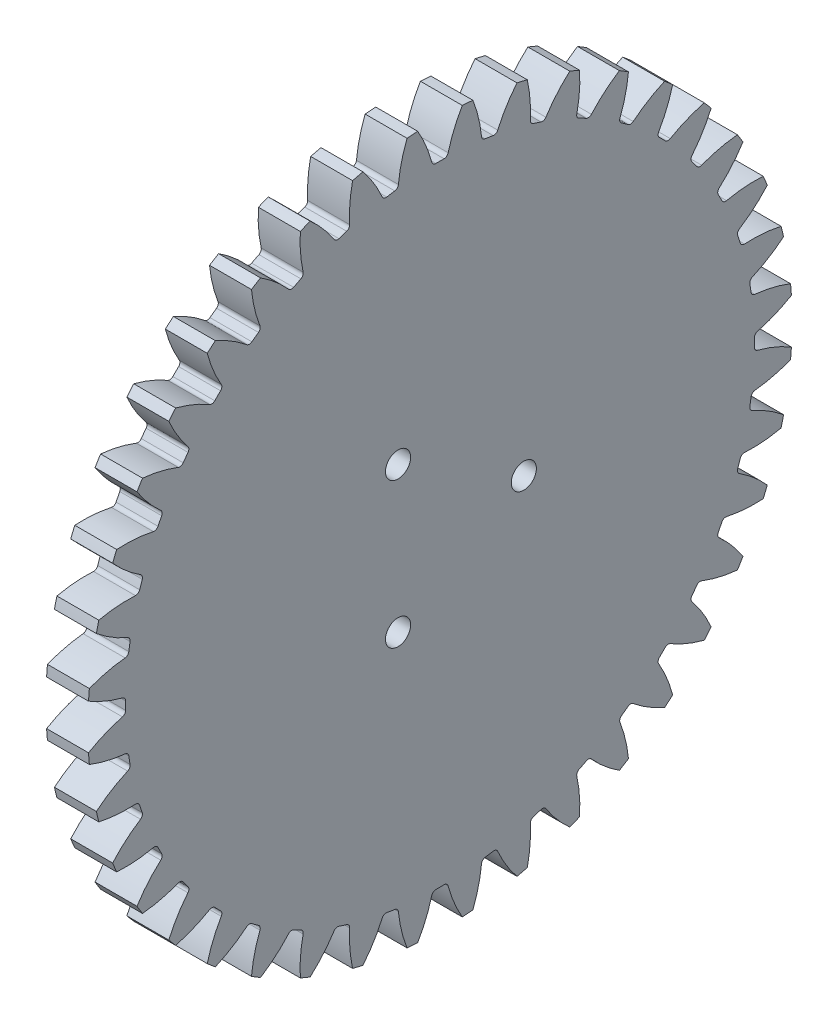
from build123d import *

# Parameters (mm, degrees)
BASPROSKE_W                = 5
BASPROSKE_H                = 42
TOOTHCUT_DEPTH             = 60.607046563
ROOTFILLETS_R              = 0.501
TEETHCUTS_COUNT            = 40
TEETHCUTS_ANGLE            = 351
ROOTFILLETS_OF_TEETHCUTS_R = 0.501
SKETCH1_R                  = 1.5
CUT_EXTRUDE1_DEPTH         = 60.487870435


with BuildPart() as part:
    # BasProSke → Base-Revolve (revolve)
    with BuildSketch(Plane(origin=(0, 0, 0), x_dir=(1, 0, 0), z_dir=(0, 1, 0))):
        with Locations((2.5, 21)):
            Rectangle(BASPROSKE_W, BASPROSKE_H)
    revolve(axis=Axis((-10, 0, 0), (1, 0, 0)))

    # TooCutSke → ToothCut (cut, through all)
    with BuildSketch(Plane(origin=(0, 0, 0), x_dir=(0, 0, -1), z_dir=(1, 0, 0))):
        with BuildLine():
            ThreePointArc((0.882812088, 37.488606854), (0, 37.499), (-0.882812088, 37.488606854))
            ThreePointArc((-0.882812088, 37.488606854), (-1.612748684, 39.782000434), (-2.678427154, 41.939960338))
            ThreePointArc((-2.678427154, 41.939960338), (0, 42.0254), (2.678427154, 41.939960338))
            ThreePointArc((2.678427154, 41.939960338), (1.612748684, 39.782000434), (0.882812088, 37.488606854))
        make_face()
    toothcut = extrude(amount=TOOTHCUT_DEPTH, mode=Mode.SUBTRACT)

    # RootFillets
    rootfillets_edges = [part.edges().sort_by_distance(p)[0] for p in [
        (2.5, 37.488606854, -0.882812088),
        (2.5, 37.488606854, 0.882812088),
    ]]
    fillet(rootfillets_edges, radius=ROOTFILLETS_R)

    # TeethCuts: ToothCut ×40 about axis
    teethcuts_axis = Axis((-10, 0, 0), (1, 0, 0))
    for i in range(1, TEETHCUTS_COUNT):
        add(toothcut.rotate(teethcuts_axis, i * TEETHCUTS_ANGLE / (TEETHCUTS_COUNT - 1)), mode=Mode.SUBTRACT)

    # RootFillets of TeethCuts
    rootfillets_of_teethcuts_edges = [part.edges().sort_by_distance(p)[0] for p in [
        (2.5, 37.165162131, 4.992566952),
        (2.5, 36.888957658, 6.736453364),
        (2.5, 35.926587773, 10.745012425),
        (2.5, 35.380979897, 12.424220802),
        (2.5, 33.80338159, 16.23288003),
        (2.5, 33.001804988, 17.80606269),
        (2.5, 30.847823966, 21.321040256),
        (2.5, 29.810016114, 22.749460219),
        (2.5, 27.132690537, 25.88420571),
        (2.5, 25.88420571, 27.132690537),
        (2.5, 22.749460219, 29.810016114),
        (2.5, 21.321040256, 30.847823966),
        (2.5, 17.80606269, 33.001804988),
        (2.5, 16.23288003, 33.80338159),
        (2.5, 12.424220802, 35.380979897),
        (2.5, 10.745012425, 35.926587773),
        (2.5, 6.736453364, 36.888957658),
        (2.5, 4.992566952, 37.165162131),
        (2.5, 0.882812088, 37.488606854),
        (2.5, -0.882812088, 37.488606854),
        (2.5, -4.992566952, 37.165162131),
        (2.5, -6.736453364, 36.888957658),
        (2.5, -10.745012425, 35.926587773),
        (2.5, -12.424220802, 35.380979897),
        (2.5, -16.23288003, 33.80338159),
        (2.5, -17.80606269, 33.001804988),
        (2.5, -21.321040256, 30.847823966),
        (2.5, -22.749460219, 29.810016114),
        (2.5, -25.88420571, 27.132690537),
        (2.5, -27.132690537, 25.88420571),
        (2.5, -29.810016114, 22.749460219),
        (2.5, -30.847823966, 21.321040256),
        (2.5, -33.001804988, 17.80606269),
        (2.5, -33.80338159, 16.23288003),
        (2.5, -35.380979897, 12.424220802),
        (2.5, -35.926587773, 10.745012425),
        (2.5, -36.888957658, 6.736453364),
        (2.5, -37.165162131, 4.992566952),
        (2.5, -37.488606854, 0.882812088),
        (2.5, -37.488606854, -0.882812088),
        (2.5, -37.165162131, -4.992566952),
        (2.5, -36.888957658, -6.736453364),
        (2.5, -35.926587773, -10.745012425),
        (2.5, -35.380979897, -12.424220802),
        (2.5, -33.80338159, -16.23288003),
        (2.5, -33.001804988, -17.80606269),
        (2.5, -30.847823966, -21.321040256),
        (2.5, -29.810016114, -22.749460219),
        (2.5, -27.132690537, -25.88420571),
        (2.5, -25.88420571, -27.132690537),
        (2.5, -22.749460219, -29.810016114),
        (2.5, -21.321040256, -30.847823966),
        (2.5, -17.80606269, -33.001804988),
        (2.5, -16.23288003, -33.80338159),
        (2.5, -12.424220802, -35.380979897),
        (2.5, -10.745012425, -35.926587773),
        (2.5, -6.736453364, -36.888957658),
        (2.5, -4.992566952, -37.165162131),
        (2.5, -0.882812088, -37.488606854),
        (2.5, 0.882812088, -37.488606854),
        (2.5, 4.992566952, -37.165162131),
        (2.5, 6.736453364, -36.888957658),
        (2.5, 10.745012425, -35.926587773),
        (2.5, 12.424220802, -35.380979897),
        (2.5, 16.23288003, -33.80338159),
        (2.5, 17.80606269, -33.001804988),
        (2.5, 21.321040256, -30.847823966),
        (2.5, 22.749460219, -29.810016114),
        (2.5, 25.88420571, -27.132690537),
        (2.5, 27.132690537, -25.88420571),
        (2.5, 29.810016114, -22.749460219),
        (2.5, 30.847823966, -21.321040256),
        (2.5, 33.001804988, -17.80606269),
        (2.5, 33.80338159, -16.23288003),
        (2.5, 35.380979897, -12.424220802),
        (2.5, 35.926587773, -10.745012425),
        (2.5, 36.888957658, -6.736453364),
        (2.5, 37.165162131, -4.992566952),
    ]]
    fillet(rootfillets_of_teethcuts_edges, radius=ROOTFILLETS_OF_TEETHCUTS_R)

    # Sketch1 → Cut-Extrude1 (cut, through all)
    with BuildSketch(Plane(origin=(5, 0, 0), x_dir=(0, 0, -1), z_dir=(1, 0, 0))):
        with Locations((-5, -8.660254038)):
            Circle(SKETCH1_R)
        with Locations((-5, 8.660254038)):
            Circle(SKETCH1_R)
        with Locations((10, 0)):
            Circle(SKETCH1_R)
    extrude(amount=-CUT_EXTRUDE1_DEPTH, mode=Mode.SUBTRACT)


solid = part.part
